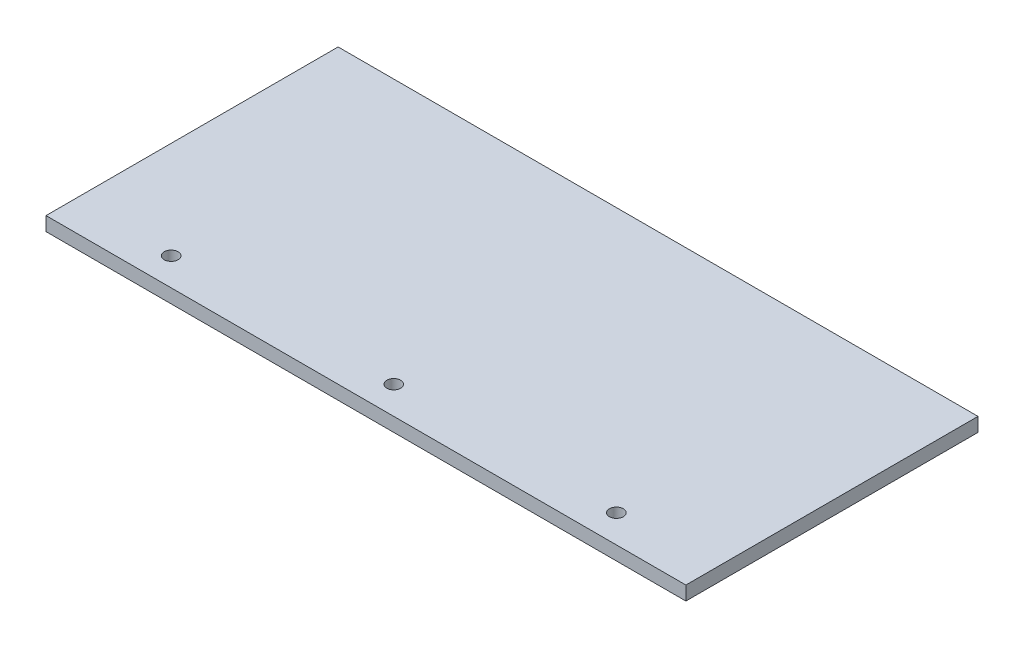
from build123d import *

# Parameters (mm, degrees)
SKETCH1_W           = 292.1
SKETCH1_H           = 133.35
BOSS_EXTRUDE1_DEPTH = 6.35
SKETCH2_R           = 3.175
CUT_EXTRUDE2_DEPTH  = 6.35


with BuildPart() as part:
    # Sketch1 → Boss-Extrude1 (new body)
    with BuildSketch(Plane(origin=(0, 0, 0), x_dir=(1, 0, 0), z_dir=(0, 1, 0))):
        with Locations((146.05, 66.675)):
            Rectangle(SKETCH1_W, SKETCH1_H)
    extrude(amount=BOSS_EXTRUDE1_DEPTH)

    # Sketch2 → Cut-Extrude2 (cut)
    with BuildSketch(Plane(origin=(0, 6.35, 0), x_dir=(1, 0, 0), z_dir=(0, 1, 0))):
        with Locations((146.05, 12.7)):
            Circle(SKETCH2_R)
        with Locations((247.65, 12.7)):
            Circle(SKETCH2_R)
        with Locations((44.45, 12.7)):
            Circle(SKETCH2_R)
    extrude(amount=-CUT_EXTRUDE2_DEPTH, mode=Mode.SUBTRACT)


solid = part.part
